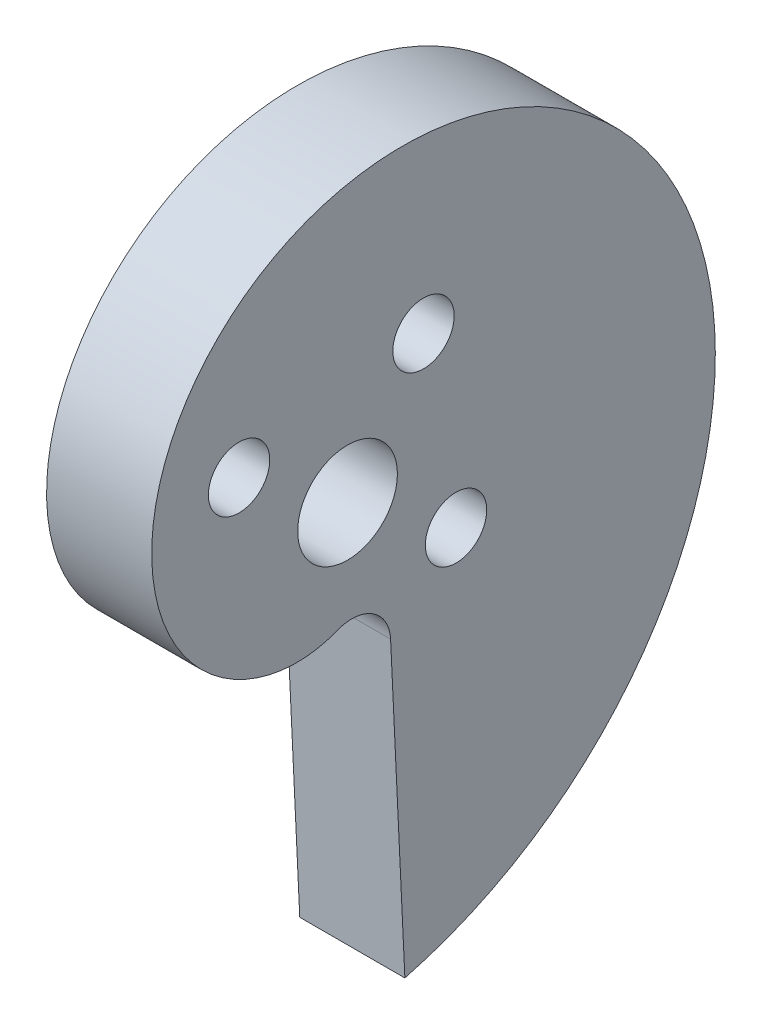
from build123d import *

# Parameters (mm, degrees)
SKETCH4_R           = 3.012699969
BOSS_EXTRUDE1_DEPTH = 6.35
MOVE_FACE1_DEPTH    = 6.35
SKETCH11_R          = 1.8542
CUT_EXTRUDE2_DEPTH  = 36.237722546


# Read off the part's stored shape, not the designer's step: Move Face1
with BuildPart() as part:
    # Sketch4 → Boss-Extrude1 (new body)
    with BuildSketch(Plane(origin=(0, 0, 0), x_dir=(0, 0, -1), z_dir=(1, 0, 0))):
        with BuildLine():
            Line((3.667013126, -26.3254835), (2.816473307, -8.431236894))
            ThreePointArc((2.816473307, -8.431236894), (1.639602622, -6.396649217), (-0.700777066, -6.179406175))
            add(Edge.make_bspline(
                [(-0.700777066, -6.179406175), (-1.525102008, -6.512822326), (-2.494871997, -6.679047096), (-4.555429578, -6.54165034), (-5.644996058, -6.237076936), (-7.717261628, -5.106975392), (-8.698405735, -4.281093265), (-10.311829803, -2.164612563), (-10.942499326, -0.874358563), (-11.647480976, 2.006859472), (-11.720427957, 3.596803483), (-11.182779689, 6.826310345), (-10.571334953, 8.46432492), (-9.132019695, 10.73433891), (-8.566197708, 11.459621106), (-7.273120414, 12.810057002), (-6.545872807, 13.435152517), (-4.948692799, 14.549748502), (-4.078780417, 15.039192621), (-2.22269385, 15.85074605), (-1.236551533, 16.172803424), (0.818678144, 16.623204755), (1.887722789, 16.751503646), (4.069669804, 16.79483508), (5.182520117, 16.709831654), (7.408648574, 16.315055224), (8.521867273, 16.00525724), (10.70264063, 15.158359498), (11.770130786, 14.621247223), (13.812561896, 13.326727542), (14.787435905, 12.56932106), (16.598938448, 10.850935673), (17.435500393, 9.889971566), (18.927885533, 7.790674993), (19.583645356, 6.652371052), (20.677096627, 4.233429246), (21.114730733, 2.952832896), (21.741586229, 0.292117033), (21.930758945, -1.087949282), (22.038932986, -3.898444365), (21.957896657, -5.328810088), (21.513783431, -8.186144708), (21.150681858, -9.613043017), (20.141400668, -12.407098951), (19.49521083, -13.774181132), (17.930076055, -16.391877744), (17.011136269, -17.642414844), (14.922264044, -19.972214517), (13.752352434, -21.051401006), (11.194349378, -22.98792657), (9.80629411, -23.845193985), (6.855009859, -25.29377098), (5.291831431, -25.88501641), (3.667013126, -26.3254835)],
                knots=[0, 0, 0, 0, 0.0625, 0.0625, 0.125, 0.125, 0.1875, 0.1875, 0.25, 0.25, 0.3125, 0.3125, 0.375, 0.375, 0.40625, 0.40625, 0.4375, 0.4375, 0.46875, 0.46875, 0.5, 0.5, 0.53125, 0.53125, 0.5625, 0.5625, 0.59375, 0.59375, 0.625, 0.625, 0.65625, 0.65625, 0.6875, 0.6875, 0.71875, 0.71875, 0.75, 0.75, 0.78125, 0.78125, 0.8125, 0.8125, 0.84375, 0.84375, 0.875, 0.875, 0.90625, 0.90625, 0.9375, 0.9375, 0.96875, 0.96875, 1, 1, 1, 1], degree=3))
        make_face()
        Circle(SKETCH4_R, mode=Mode.SUBTRACT)
    extrude(amount=BOSS_EXTRUDE1_DEPTH)

    # Move Face1 outline → Move Face1 (add)
    with BuildSketch(Plane.YZ):
        with BuildLine():
            Line((-8.441487365, -2.600816779), (-26.604178645, -3.464116168))
            add(Edge.make_bspline(
                [(-26.604178645, -3.464116168), (-26.599569003, -3.481120458), (-26.594959362, -3.498124748), (-26.59034972, -3.515129038), (-26.585740078, -3.532133328), (-26.581130437, -3.549137618), (-26.576520795, -3.566141908), (-26.571911153, -3.583146198), (-26.567301512, -3.600150488), (-26.56269187, -3.617154778), (-26.558082228, -3.634159068), (-26.553472587, -3.651163358), (-26.548862945, -3.668167648), (-26.544253303, -3.685171938), (-26.53927128, -3.703549889), (-26.538898899, -3.704923549), (-26.538526517, -3.70629721), (-26.538154136, -3.707670871), (-26.537781754, -3.709044531), (-26.537409373, -3.710418192), (-26.537036991, -3.711791852), (-26.53666461, -3.713165513), (-26.536292228, -3.714539173), (-26.535919847, -3.715912834), (-26.535547465, -3.717286495), (-26.535175084, -3.718660155), (-26.534802702, -3.720033816), (-26.53424413, -3.722094307), (-26.534059907, -3.722773916), (-26.533858021, -3.723518442), (-26.533727067, -3.724001851), (-26.533440048, -3.725060798), (-26.533340537, -3.725426825), (-26.533133021, -3.726192717), (-26.532893488, -3.727076218), (-26.532782162, -3.727485594), (-26.532537582, -3.728388165), (-26.532375797, -3.728983938), (-26.532180677, -3.729703197), (-26.531993743, -3.730392017), (-26.531617908, -3.731776793), (-26.531429971, -3.732469173), (-26.531242014, -3.733161545), (-26.531054038, -3.733853909), (-26.530866042, -3.734546265), (-26.530678027, -3.735238614), (-26.530489992, -3.735930954), (-26.530301938, -3.736623286), (-26.530113864, -3.73731561), (-26.529925771, -3.738007927), (-26.529737659, -3.738700235), (-26.529549527, -3.739392535), (-26.529361375, -3.740084828), (-26.528420519, -3.74354625), (-26.527667523, -3.74631526), (-26.526914215, -3.749084142), (-26.526160594, -3.751852897), (-26.525406663, -3.754621524), (-26.524652417, -3.757390023), (-26.523897864, -3.760158394), (-26.523142994, -3.762926638), (-26.522387816, -3.765694753), (-26.521632324, -3.768462741), (-26.520876522, -3.7712306), (-26.520120408, -3.773998332), (-26.519363982, -3.776765936), (-26.517093769, -3.785068362), (-26.515579047, -3.790602801), (-26.514063078, -3.796136728), (-26.512545864, -3.801670141), (-26.511027403, -3.807203041), (-26.509507697, -3.812735429), (-26.507986745, -3.818267302), (-26.506464548, -3.823798661), (-26.504941106, -3.829329506), (-26.503416418, -3.834859837), (-26.501890486, -3.840389653), (-26.500363309, -3.845918954), (-26.498834888, -3.85144774), (-26.494245891, -3.868032549), (-26.491181583, -3.879087027), (-26.488112299, -3.890139439), (-26.485038042, -3.901189785), (-26.481958812, -3.912238061), (-26.478874612, -3.923284266), (-26.475785441, -3.934328398), (-26.472691304, -3.945370453), (-26.4695922, -3.956410431), (-26.466488131, -3.967448328), (-26.463379099, -3.978484142), (-26.460265106, -3.989517871), (-26.457146153, -4.000549514), (-26.441526593, -4.055697279), (-26.428951609, -4.099782062), (-26.416297387, -4.143833272), (-26.403564026, -4.187850766), (-26.390751622, -4.2318344), (-26.377860278, -4.275784033), (-26.364890086, -4.31969952), (-26.351841151, -4.363580717), (-26.338713566, -4.407427483), (-26.325507433, -4.451239673), (-26.312222848, -4.495017144), (-26.298859911, -4.538759754), (-26.285418719, -4.582467358), (-26.217821979, -4.800829638), (-26.162494118, -4.974957082), (-26.105922065, -5.148512984), (-26.048112096, -5.321488181), (-25.989070491, -5.49387351), (-25.928803524, -5.665659807), (-25.867317478, -5.836837911), (-25.804618624, -6.007398657), (-25.740713246, -6.177332884), (-25.675607616, -6.346631428), (-25.609308015, -6.515285126), (-25.541820718, -6.683284815), (-25.473152005, -6.850621333), (-25.263620445, -7.350613883), (-25.119234857, -7.681244245), (-24.970181526, -8.009184855), (-24.816563128, -8.334008567), (-24.658405438, -8.656540908), (-24.495574442, -8.975326705), (-24.328540305, -9.291435032), (-24.157090549, -9.604622916), (-23.981161893, -9.914157206), (-23.801250109, -10.220890306), (-23.616969066, -10.524098117), (-23.428657045, -10.824036045), (-23.23626742, -11.120542818), (-22.843508974, -11.706612059), (-22.643142176, -11.996174333), (-22.438808393, -12.282198027), (-22.230723583, -12.56460565), (-22.018648797, -12.843459923), (-21.802917467, -13.118447754), (-21.583605212, -13.389644606), (-21.360601243, -13.657176078), (-21.134077845, -13.920797741), (-20.904199437, -14.180403567), (-20.670850853, -14.43621903), (-20.434249131, -14.687936687), (-20.194399706, -14.935644556), (-19.70838235, -15.42287054), (-19.462215458, -15.662397811), (-19.212931723, -15.897766285), (-18.960728671, -16.128991264), (-18.70539447, -16.355994955), (-18.447304202, -16.578625492), (-18.186499944, -16.796967202), (-17.922857209, -17.011060359), (-17.656599224, -17.220738444), (-17.387896766, -17.42596103), (-17.116588056, -17.626860373), (-16.842954408, -17.82323191), (-16.566974945, -18.015139117), (-16.010532784, -18.389907039), (-15.730066911, -18.572777232), (-15.447424653, -18.751061226), (-15.162746667, -18.924851219), (-14.875916093, -19.093949929), (-14.587276398, -19.258367365), (-14.296840097, -19.418183126), (-14.004513923, -19.573354608), (-13.710535007, -19.723805382), (-13.415054471, -19.869556513), (-13.117916757, -20.010637113), (-12.819417073, -20.146961011), (-12.519527346, -20.278558541), (-11.917189037, -20.532242336), (-11.614733643, -20.65433651), (-11.311086848, -20.771622769), (-11.006314451, -20.884236095), (-10.700430715, -20.991914806), (-10.39369458, -21.094796517), (-10.086097937, -21.192946197), (-9.777608438, -21.286263743), (-9.468444303, -21.374756831), (-9.158720169, -21.458492374), (-8.848328151, -21.537414262), (-8.537533287, -21.611545146), (-8.226317575, -21.68088471), (-7.603260387, -21.809981168), (-7.291409675, -21.869743076), (-6.979352707, -21.924681004), (-6.667077965, -21.974937355), (-6.354741362, -22.020247701), (-6.042483137, -22.060828702), (-5.730286129, -22.096726163), (-5.418195248, -22.127815836), (-5.10638259, -22.154172495), (-4.794917194, -22.175889882), (-4.483768614, -22.19285834), (-4.173135796, -22.205184806), (-3.863025065, -22.212847752), (-3.244042, -22.218898546), (-2.935160635, -22.217283683), (-2.627009812, -22.211051294), (-2.319535889, -22.200221076), (-2.012978585, -22.184764162), (-1.707390049, -22.164745089), (-1.402745405, -22.140231054), (-1.099140461, -22.111224435), (-0.796711927, -22.077727229), (-0.495491172, -22.03980106), (-0.195495425, -21.997498698), (0.103120125, -21.950796576), (0.400341286, -21.899765548), (0.991819558, -21.789077387), (1.28608355, -21.729419077), (1.578768432, -21.665496674), (1.869917455, -21.597302553), (2.159298453, -21.524877058), (2.446882891, -21.44828864), (2.732707168, -21.367584679), (3.016672969, -21.282790594), (3.298648908, -21.193943649), (3.578623787, -21.101102717), (3.85659217, -21.004314712), (4.132391722, -20.903599993), (4.406031128, -20.799020335), (4.948821205, -20.582201458), (5.217977174, -20.469959264), (5.484813738, -20.353954278), (5.749350964, -20.234161295), (6.01138819, -20.110681465), (6.270917632, -19.983580155), (6.527976619, -19.852885482), (6.782472092, -19.718646938), (7.034289441, -19.580933449), (7.283432367, -19.43979613), (7.529901875, -19.295274808), (7.77354503, -19.147434253), (8.014385292, -18.996321733), (8.490309508, -18.687660003), (8.725396651, -18.530106846), (8.957555599, -18.369412167), (9.186776625, -18.205547192), (9.412909718, -18.038656901), (9.635962414, -17.868799381), (9.855964095, -17.695988596), (10.072835585, -17.520295455), (10.286488685, -17.341812823), (10.496935081, -17.160582706), (10.704177349, -16.976639307), (10.908088748, -16.790084702), (11.108697582, -16.60095136), (11.503188846, -16.217665056), (11.697072069, -16.023508272), (11.887567215, -15.826919792), (12.074634411, -15.627883555), (12.258185431, -15.42656542), (12.438237852, -15.223014525), (12.614807781, -15.017239038), (12.787836646, -14.809325702), (12.957268738, -14.599380603), (13.123118176, -14.387438261), (13.285386007, -14.173530705), (13.443983714, -13.9577844), (13.598936774, -13.740220791), (13.901469825, -13.301617581), (14.049048428, -13.080575457), (14.192938252, -12.85786673), (14.333075884, -12.633504041), (14.469436513, -12.407648424), (14.602043246, -12.180340569), (14.730898025, -11.951592848), (14.855967044, -11.721500116), (14.977228845, -11.490169384), (15.094696526, -11.257631481), (15.208368824, -11.023920803), (15.318201343, -10.789171515), (15.424212302, -10.553400689), (15.62854924, -10.079983096), (15.726872378, -9.842336108), (15.821368333, -9.603809457), (15.911963677, -9.364456828), (15.998688398, -9.124410274), (16.081568069, -8.883704025), (16.160594519, -8.642364015), (16.235759672, -8.400484565), (16.307073362, -8.15816166), (16.374546973, -7.915427103), (16.438178826, -7.672322007), (16.497967314, -7.428970727), (16.553923089, -7.185393613), (16.658169192, -6.697950384), (16.706458163, -6.454088263), (16.750931294, -6.210116308), (16.791551227, -5.966156004), (16.828352164, -5.722265003), (16.861371473, -5.478483856), (16.89061727, -5.234873215), (16.916091026, -4.991505669), (16.937812625, -4.748444975), (16.955811803, -4.505744551), (16.970101403, -4.263463823), (16.98068149, -4.021672476), (16.987586075, -3.780425869), (16.994060031, -3.299148156), (16.993631026, -3.059123221), (16.989555385, -2.819737011), (16.981828074, -2.581119041), (16.97049256, -2.343310945), (16.955590155, -2.106340667), (16.937140606, -1.870268338), (16.91516095, -1.635166239), (16.889682937, -1.401088709), (16.860744509, -1.168076804), (16.828369507, -0.936186685), (16.792572797, -0.705489655), (16.753396921, -0.476025059), (16.668327332, -0.019684131), (16.622436928, 0.207187985), (16.573210516, 0.43274012), (16.520676595, 0.656845924), (16.464882551, 0.879479604), (16.405870334, 1.100624284), (16.3436718, 1.320223268), (16.278319602, 1.538208936), (16.209854217, 1.754538123), (16.138317988, 1.969182142), (16.063745228, 2.182090339), (15.986166539, 2.393194111), (15.905627626, 2.602469813), (15.738694717, 3.017250287), (15.652304686, 3.222753348), (15.563011722, 3.426348397), (15.470874943, 3.627923175), (15.375941264, 3.827466031), (15.27825116, 4.024968988), (15.177848129, 4.22038201), (15.074779017, 4.413646484), (14.969089842, 4.604731213), (14.860824208, 4.793618869), (14.750025822, 4.980266585), (14.6367404, 5.164613119), (14.521012434, 5.346648599), (14.284759964, 5.705997611), (14.164238936, 5.88331198), (14.041346931, 6.058244698), (13.916166576, 6.230707349), (13.788741729, 6.400699169), (13.659110682, 6.568218603), (13.527326668, 6.733225876), (13.393447683, 6.895675454), (13.257522548, 7.055547765), (13.11959423, 7.212834846), (12.979713874, 7.367503996), (12.837939646, 7.519506253), (12.694312503, 7.668841812), (12.403459758, 7.962101433), (12.256236093, 8.106028416), (12.107245062, 8.247230378), (11.956582639, 8.385649016), (11.804288588, 8.521291455), (11.65039943, 8.654160681), (11.494975113, 8.78422985), (11.338080513, 8.911469301), (11.179764974, 9.035870418), (11.020069941, 9.157432821), (10.859051406, 9.276135657), (10.696775757, 9.391945779), (10.53327979, 9.504870215), (10.348041361, 9.62863484), (10.327440973, 9.642341074), (10.306822731, 9.656001739), (10.286186731, 9.669616814), (10.265532905, 9.683186339), (10.244861188, 9.696710349), (10.224171615, 9.710188832), (10.203464367, 9.723621723), (10.182739741, 9.737008906), (10.161998068, 9.750350261), (10.141239561, 9.763645725), (10.12046411, 9.776895389), (10.099671, 9.79009961), (10.058046161, 9.81641871), (10.037217098, 9.829531834), (10.016371494, 9.842598537), (9.995509453, 9.855618821), (9.974631077, 9.868592692), (9.953736471, 9.881520152), (9.932825737, 9.894401206), (9.911898978, 9.907235857), (9.890956298, 9.920024109), (9.869997801, 9.932765967), (9.849023589, 9.945461434), (9.828033765, 9.958110514), (9.807028434, 9.97071321), (9.743966224, 10.00838216), (9.701863133, 10.033309276), (9.659699249, 10.058050905), (9.617475395, 10.082607077), (9.575192397, 10.106977826), (9.532851077, 10.131163181), (9.490452261, 10.155163174), (9.447996771, 10.178977836), (9.405485434, 10.202607198), (9.362919072, 10.226051291), (9.320298511, 10.249310147), (9.277624573, 10.272383796), (9.234898083, 10.29527227), (9.106563432, 10.363382261), (9.020800116, 10.408048353), (8.934836483, 10.451974125), (8.848679096, 10.495159823), (8.762334519, 10.537605698), (8.675809318, 10.579311995), (8.589110055, 10.620278965), (8.502243296, 10.660506853), (8.415215603, 10.699995909), (8.328033542, 10.73874638), (8.240703676, 10.776758515), (8.15323257, 10.814032561), (8.065626787, 10.850568766), (7.802425101, 10.957964605), (7.626444742, 11.026611369), (7.450004147, 11.092309662), (7.27315561, 11.155061426), (7.095951384, 11.214868552), (6.918443686, 11.271732888), (6.740684687, 11.325656229), (6.562726523, 11.376640328), (6.384621288, 11.424686885), (6.206421038, 11.469797554), (6.028177787, 11.511973941), (5.84994351, 11.551217606), (5.671770144, 11.587530057), (5.315649022, 11.654295458), (5.137728602, 11.684747226), (4.959700016, 11.712299475), (4.783019884, 11.736712222), (4.604276011, 11.758891306), (4.429464411, 11.777036031), (4.250811556, 11.793890793), (4.076436597, 11.806370641), (3.899761626, 11.817263639), (3.725133165, 11.824666119), (3.550410334, 11.829638498), (3.37648165, 11.831780195), (3.203155326, 11.831236863), (2.857881444, 11.824777298), (2.685930065, 11.818863209), (2.51470827, 11.810286856), (2.344260063, 11.799070213), (2.174629427, 11.785235191), (2.005860324, 11.768803637), (1.837996698, 11.749797331), (1.671082472, 11.728237989), (1.50516155, 11.704147262), (1.340277816, 11.677546737), (1.176475132, 11.648457935), (1.013797343, 11.616902313), (0.852288272, 11.582901263), (0.61184345, 11.528263534), (0.53200571, 11.509447542), (0.452431498, 11.490014724), (0.373262519, 11.470000825), (0.294382178, 11.449393041), (0.215797381, 11.428191413), (0.137577788, 11.406409742), (0.059709652, 11.384053465), (-0.017850954, 11.361120913), (-0.095072103, 11.33761765), (-0.171912733, 11.313553202), (-0.248433789, 11.288926884), (-0.324588602, 11.263745774), (-0.476187787, 11.21228181), (-0.551629997, 11.185999058), (-0.626711201, 11.159170067), (-0.701427774, 11.131799368), (-0.775776089, 11.103891494), (-0.849752523, 11.075450975), (-0.92335345, 11.046482344), (-0.996575245, 11.016990131), (-1.069414282, 10.986978867), (-1.141866938, 10.956453085), (-1.213929586, 10.925417316), (-1.285598602, 10.89387609), (-1.35687036, 10.86183394), (-1.569482988, 10.764218312), (-1.709621229, 10.697155476), (-1.848127108, 10.628143005), (-1.98497177, 10.557216936), (-2.120126347, 10.484413233), (-2.253561967, 10.409767786), (-2.385249746, 10.333316406), (-2.515160795, 10.255094835), (-2.643266216, 10.175138734), (-2.769537102, 10.093483694), (-2.893944539, 10.010165228), (-3.016459604, 9.925218776), (-3.137053367, 9.838679702), (-3.315018649, 9.706535092), (-3.373849905, 9.662101445), (-3.432225085, 9.617246491), (-3.489973308, 9.572127532), (-3.547384771, 9.52651408), (-3.604222119, 9.480589049), (-3.660493818, 9.43435795), (-3.716362737, 9.387700649), (-3.771715305, 9.340702599), (-3.826473613, 9.293429538), (-3.880830859, 9.245743042), (-3.934616774, 9.197770987), (-3.987913252, 9.149459099), (-4.093478067, 9.052199488), (-4.145749357, 9.003249721), (-4.19750826, 8.953985292), (-4.248753506, 8.904411497), (-4.299483825, 8.854533635), (-4.349697947, 8.804357003), (-4.399394603, 8.753886901), (-4.448572522, 8.703128624), (-4.497230434, 8.652087473), (-4.545367069, 8.600768744), (-4.592981158, 8.549177736), (-4.640071431, 8.497319746), (-4.686636617, 8.445200073), (-4.824753105, 8.288071896), (-4.914725275, 8.182294046), (-5.002581891, 8.075532644), (-5.088312844, 7.967829797), (-5.171907984, 7.859227538), (-5.253357116, 7.749767825), (-5.332650002, 7.639492543), (-5.409776362, 7.528443501), (-5.48472587, 7.416662437), (-5.55748816, 7.304191013), (-5.628052821, 7.191070818), (-5.696409398, 7.077343365), (-5.762547394, 6.963050096), (-5.890365144, 6.733414655), (-5.952053709, 6.61804774), (-6.011379226, 6.5024593), (-6.068789532, 6.385932229), (-6.123482319, 6.2698429), (-6.176476599, 6.152615371), (-6.226996856, 6.035513752), (-6.275228474, 5.918322644), (-6.321621575, 5.800380212), (-6.365473581, 5.682832438), (-6.407390636, 5.564799764), (-6.447052072, 5.446825396), (-6.484587524, 5.328765169), (-6.55536853, 5.092635858), (-6.588616961, 4.974562342), (-6.619731944, 4.856519728), (-6.64872202, 4.73854772), (-6.675595644, 4.620685966), (-6.700361191, 4.50297406), (-6.723026952, 4.385451536), (-6.743601132, 4.268157874), (-6.762091856, 4.151132495), (-6.778507164, 4.034414767), (-6.792855012, 3.918043998), (-6.805143275, 3.802059442), (-6.815379741, 3.686500296), (-6.839956872, 3.341216503), (-6.848154204, 3.113073347), (-6.848438469, 2.887099769), (-6.84084938, 2.663718746), (-6.825763132, 2.443005573), (-6.803253008, 2.225285636), (-6.773501282, 2.01082461), (-6.73678547, 1.799796855), (-6.69324338, 1.592468222), (-6.643018498, 1.389115017), (-6.586393416, 1.18991247), (-6.52346955, 0.995146747), (-6.454467342, 0.805035191), (-6.379554183, 0.619822851)],
                knots=[-0.001662915, -0.001662915, -0.001662915, -0.001662915, -0.001662915, -0.001662915, -0.001662915, -0.001662915, -0.001662915, -0.001662915, -0.001662915, -0.001662915, -0.001662915, -0.001662915, -0.001662915, -0.000136719, -0.000136719, -0.000136719, -0.000136719, -0.000136719, -0.000136719, -0.000136719, -0.000136719, -0.000136719, -0.000136719, -0.000136719, -0.000136719, -0.000136719, -1.3428e-05, -1.3428e-05, -1.3428e-05, -1.3428e-05, -1.3428e-05, -1.3428e-05, -1.3428e-05, -1.3428e-05, -1.3428e-05, -1.3428e-05, -1.3428e-05, -1.3428e-05, -1.3428e-05, 4.8218e-05, 4.8218e-05, 4.8218e-05, 4.8218e-05, 4.8218e-05, 4.8218e-05, 4.8218e-05, 4.8218e-05, 4.8218e-05, 4.8218e-05, 4.8218e-05, 4.8218e-05, 4.8218e-05, 0.000109863, 0.000109863, 0.000109863, 0.000109863, 0.000109863, 0.000109863, 0.000109863, 0.000109863, 0.000109863, 0.000109863, 0.000109863, 0.000109863, 0.000109863, 0.000356445, 0.000356445, 0.000356445, 0.000356445, 0.000356445, 0.000356445, 0.000356445, 0.000356445, 0.000356445, 0.000356445, 0.000356445, 0.000356445, 0.000356445, 0.000849609, 0.000849609, 0.000849609, 0.000849609, 0.000849609, 0.000849609, 0.000849609, 0.000849609, 0.000849609, 0.000849609, 0.000849609, 0.000849609, 0.000849609, 0.001835937, 0.001835937, 0.001835937, 0.001835937, 0.001835937, 0.001835937, 0.001835937, 0.001835937, 0.001835937, 0.001835937, 0.001835937, 0.001835937, 0.001835937, 0.00578125, 0.00578125, 0.00578125, 0.00578125, 0.00578125, 0.00578125, 0.00578125, 0.00578125, 0.00578125, 0.00578125, 0.00578125, 0.00578125, 0.00578125, 0.0215625, 0.0215625, 0.0215625, 0.0215625, 0.0215625, 0.0215625, 0.0215625, 0.0215625, 0.0215625, 0.0215625, 0.0215625, 0.0215625, 0.0215625, 0.053125, 0.053125, 0.053125, 0.053125, 0.053125, 0.053125, 0.053125, 0.053125, 0.053125, 0.053125, 0.053125, 0.053125, 0.053125, 0.0846875, 0.0846875, 0.0846875, 0.0846875, 0.0846875, 0.0846875, 0.0846875, 0.0846875, 0.0846875, 0.0846875, 0.0846875, 0.0846875, 0.0846875, 0.11625, 0.11625, 0.11625, 0.11625, 0.11625, 0.11625, 0.11625, 0.11625, 0.11625, 0.11625, 0.11625, 0.11625, 0.11625, 0.1478125, 0.1478125, 0.1478125, 0.1478125, 0.1478125, 0.1478125, 0.1478125, 0.1478125, 0.1478125, 0.1478125, 0.1478125, 0.1478125, 0.1478125, 0.179375, 0.179375, 0.179375, 0.179375, 0.179375, 0.179375, 0.179375, 0.179375, 0.179375, 0.179375, 0.179375, 0.179375, 0.179375, 0.2109375, 0.2109375, 0.2109375, 0.2109375, 0.2109375, 0.2109375, 0.2109375, 0.2109375, 0.2109375, 0.2109375, 0.2109375, 0.2109375, 0.2109375, 0.2425, 0.2425, 0.2425, 0.2425, 0.2425, 0.2425, 0.2425, 0.2425, 0.2425, 0.2425, 0.2425, 0.2425, 0.2425, 0.2740625, 0.2740625, 0.2740625, 0.2740625, 0.2740625, 0.2740625, 0.2740625, 0.2740625, 0.2740625, 0.2740625, 0.2740625, 0.2740625, 0.2740625, 0.305625, 0.305625, 0.305625, 0.305625, 0.305625, 0.305625, 0.305625, 0.305625, 0.305625, 0.305625, 0.305625, 0.305625, 0.305625, 0.3371875, 0.3371875, 0.3371875, 0.3371875, 0.3371875, 0.3371875, 0.3371875, 0.3371875, 0.3371875, 0.3371875, 0.3371875, 0.3371875, 0.3371875, 0.36875, 0.36875, 0.36875, 0.36875, 0.36875, 0.36875, 0.36875, 0.36875, 0.36875, 0.36875, 0.36875, 0.36875, 0.36875, 0.4003125, 0.4003125, 0.4003125, 0.4003125, 0.4003125, 0.4003125, 0.4003125, 0.4003125, 0.4003125, 0.4003125, 0.4003125, 0.4003125, 0.4003125, 0.431875, 0.431875, 0.431875, 0.431875, 0.431875, 0.431875, 0.431875, 0.431875, 0.431875, 0.431875, 0.431875, 0.431875, 0.431875, 0.4634375, 0.4634375, 0.4634375, 0.4634375, 0.4634375, 0.4634375, 0.4634375, 0.4634375, 0.4634375, 0.4634375, 0.4634375, 0.4634375, 0.4634375, 0.495, 0.495, 0.495, 0.495, 0.495, 0.495, 0.495, 0.495, 0.495, 0.495, 0.495, 0.495, 0.495, 0.5265625, 0.5265625, 0.5265625, 0.5265625, 0.5265625, 0.5265625, 0.5265625, 0.5265625, 0.5265625, 0.5265625, 0.5265625, 0.5265625, 0.5265625, 0.558125, 0.558125, 0.558125, 0.558125, 0.558125, 0.558125, 0.558125, 0.558125, 0.558125, 0.558125, 0.558125, 0.558125, 0.558125, 0.5896875, 0.5896875, 0.5896875, 0.5896875, 0.5896875, 0.5896875, 0.5896875, 0.5896875, 0.5896875, 0.5896875, 0.5896875, 0.5896875, 0.5896875, 0.62125, 0.62125, 0.62125, 0.62125, 0.62125, 0.62125, 0.62125, 0.62125, 0.62125, 0.62125, 0.62125, 0.62125, 0.62125, 0.625195313, 0.625195313, 0.625195313, 0.625195313, 0.625195313, 0.625195313, 0.625195313, 0.625195313, 0.625195313, 0.625195313, 0.625195313, 0.625195313, 0.625195313, 0.629140625, 0.629140625, 0.629140625, 0.629140625, 0.629140625, 0.629140625, 0.629140625, 0.629140625, 0.629140625, 0.629140625, 0.629140625, 0.629140625, 0.629140625, 0.63703125, 0.63703125, 0.63703125, 0.63703125, 0.63703125, 0.63703125, 0.63703125, 0.63703125, 0.63703125, 0.63703125, 0.63703125, 0.63703125, 0.63703125, 0.6528125, 0.6528125, 0.6528125, 0.6528125, 0.6528125, 0.6528125, 0.6528125, 0.6528125, 0.6528125, 0.6528125, 0.6528125, 0.6528125, 0.6528125, 0.684375, 0.684375, 0.684375, 0.684375, 0.684375, 0.684375, 0.684375, 0.684375, 0.684375, 0.684375, 0.684375, 0.684375, 0.684375, 0.7159375, 0.7159375, 0.7159375, 0.7159375, 0.7159375, 0.7159375, 0.7159375, 0.7159375, 0.7159375, 0.7159375, 0.7159375, 0.7159375, 0.7159375, 0.7475, 0.7475, 0.7475, 0.7475, 0.7475, 0.7475, 0.7475, 0.7475, 0.7475, 0.7475, 0.7475, 0.7475, 0.7475, 0.76328125, 0.76328125, 0.76328125, 0.76328125, 0.76328125, 0.76328125, 0.76328125, 0.76328125, 0.76328125, 0.76328125, 0.76328125, 0.76328125, 0.76328125, 0.7790625, 0.7790625, 0.7790625, 0.7790625, 0.7790625, 0.7790625, 0.7790625, 0.7790625, 0.7790625, 0.7790625, 0.7790625, 0.7790625, 0.7790625, 0.810625, 0.810625, 0.810625, 0.810625, 0.810625, 0.810625, 0.810625, 0.810625, 0.810625, 0.810625, 0.810625, 0.810625, 0.810625, 0.82640625, 0.82640625, 0.82640625, 0.82640625, 0.82640625, 0.82640625, 0.82640625, 0.82640625, 0.82640625, 0.82640625, 0.82640625, 0.82640625, 0.82640625, 0.8421875, 0.8421875, 0.8421875, 0.8421875, 0.8421875, 0.8421875, 0.8421875, 0.8421875, 0.8421875, 0.8421875, 0.8421875, 0.8421875, 0.8421875, 0.87375, 0.87375, 0.87375, 0.87375, 0.87375, 0.87375, 0.87375, 0.87375, 0.87375, 0.87375, 0.87375, 0.87375, 0.87375, 0.9053125, 0.9053125, 0.9053125, 0.9053125, 0.9053125, 0.9053125, 0.9053125, 0.9053125, 0.9053125, 0.9053125, 0.9053125, 0.9053125, 0.9053125, 0.936875, 0.936875, 0.936875, 0.936875, 0.936875, 0.936875, 0.936875, 0.936875, 0.936875, 0.936875, 0.936875, 0.936875, 0.936875, 1, 1, 1, 1, 1, 1, 1, 1, 1, 1, 1, 1, 1, 1, 1], degree=14))
            ThreePointArc((-6.379554183, 0.619822851), (-6.578477057, -1.52319194), (-8.441487365, -2.600816779))
        make_face()
        with BuildLine():
            add(Edge.make_bspline(
                [(-26.3254835, -3.667013126), (-25.88501641, -5.291831431), (-25.29377098, -6.855009859), (-23.845193985, -9.80629411), (-22.98792657, -11.194349378), (-21.051401006, -13.752352434), (-19.972214517, -14.922264044), (-17.642414844, -17.011136269), (-16.391877744, -17.930076055), (-13.774181132, -19.49521083), (-12.407098951, -20.141400668), (-9.613043017, -21.150681858), (-8.186144708, -21.513783431), (-5.328810088, -21.957896657), (-3.898444365, -22.038932986), (-1.087949282, -21.930758945), (0.292117033, -21.741586229), (2.952832896, -21.114730733), (4.233429246, -20.677096627), (6.652371052, -19.583645356), (7.790674993, -18.927885533), (9.889971566, -17.435500393), (10.850935673, -16.598938448), (12.56932106, -14.787435905), (13.326727542, -13.812561896), (14.621247223, -11.770130786), (15.158359498, -10.70264063), (16.00525724, -8.521867273), (16.315055224, -7.408648574), (16.709831654, -5.182520117), (16.79483508, -4.069669804), (16.751503646, -1.887722789), (16.623204755, -0.818678144), (16.172803424, 1.236551533), (15.85074605, 2.22269385), (15.039192621, 4.078780417), (14.549748502, 4.948692799), (13.435152517, 6.545872807), (12.810057002, 7.273120414), (11.459621106, 8.566197708), (10.73433891, 9.132019695), (8.46432492, 10.571334953), (6.826310345, 11.182779689), (3.596803483, 11.720427957), (2.006859472, 11.647480976), (-0.874358563, 10.942499326), (-2.164612563, 10.311829803), (-4.281093265, 8.698405735), (-5.106975392, 7.717261628), (-6.237076936, 5.644996058), (-6.54165034, 4.555429578), (-6.679047096, 2.494871997), (-6.512822326, 1.525102008), (-6.179406175, 0.700777066)],
                knots=[0, 0, 0, 0, 0.03125, 0.03125, 0.0625, 0.0625, 0.09375, 0.09375, 0.125, 0.125, 0.15625, 0.15625, 0.1875, 0.1875, 0.21875, 0.21875, 0.25, 0.25, 0.28125, 0.28125, 0.3125, 0.3125, 0.34375, 0.34375, 0.375, 0.375, 0.40625, 0.40625, 0.4375, 0.4375, 0.46875, 0.46875, 0.5, 0.5, 0.53125, 0.53125, 0.5625, 0.5625, 0.59375, 0.59375, 0.625, 0.625, 0.6875, 0.6875, 0.75, 0.75, 0.8125, 0.8125, 0.875, 0.875, 0.9375, 0.9375, 1, 1, 1, 1], degree=3))
            Line((-26.3254835, -3.667013126), (-8.431236894, -2.816473307))
            ThreePointArc((-8.431236894, -2.816473307), (-6.396649217, -1.639602622), (-6.179406175, 0.700777066))
        make_face(mode=Mode.SUBTRACT)
    extrude(amount=MOVE_FACE1_DEPTH)

    # Sketch11 → Cut-Extrude2 (cut, through all)
    with BuildSketch(Plane.ZY):
        with Locations((-6.553216354, -4.588611491)):
            Circle(SKETCH11_R)
        with Locations((-4.588611491, 6.553216354)):
            Circle(SKETCH11_R)
        with Locations((6.553216354, 4.588611491)):
            Circle(SKETCH11_R)
    extrude(amount=-CUT_EXTRUDE2_DEPTH, mode=Mode.SUBTRACT)


solid = part.part
